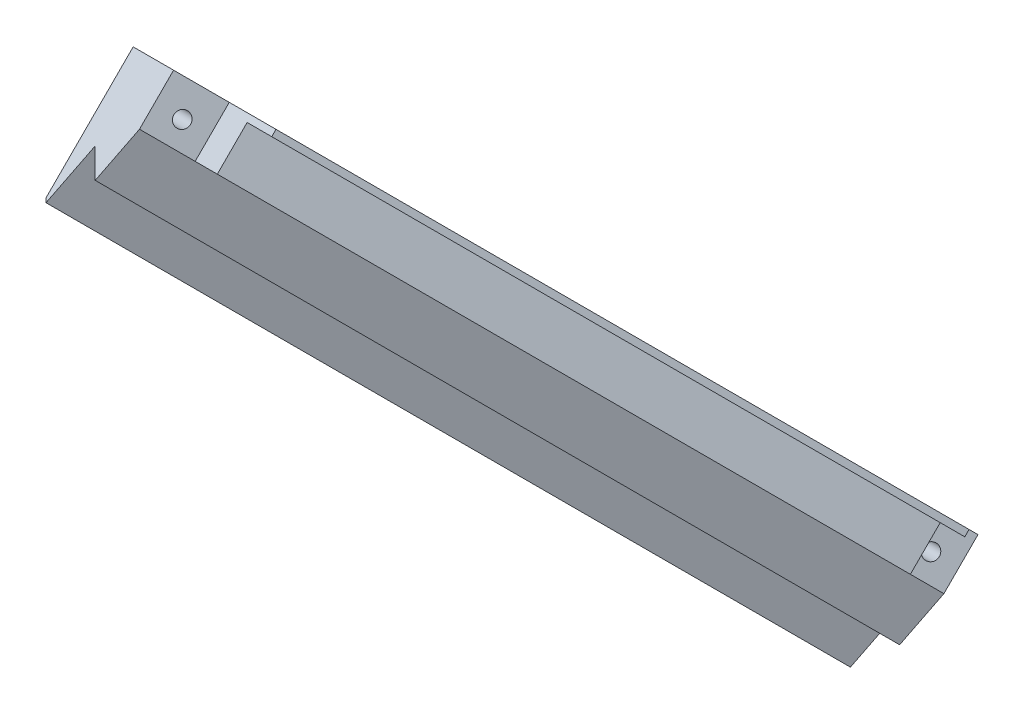
from build123d import *
from build123d.topology import SkipClean

# Parameters (mm, degrees)
STOCK_GOUX_START         = -74.233053816
STOCK_GOUX_LIKED_1_DEPTH = 57.798154544
BOSS_EXTRUDE1_DEPTH      = 57.798155
CUT_EXTRUDE1_DEPTH       = 117.763925236
SKETCH6_R                = 0.6
CUT_EXTRUDE2_DEPTH       = 156.868172362
CUT_EXTRUDE4_DEPTH       = 0.4


# Read off the part's stored shape, not the designer's step: Stock-Goux Liked-1
with BuildPart() as part:
    # Stock-Goux Liked-1 outline → Stock-Goux Liked-1 (new body)
    with BuildSketch(Plane(origin=(0, 0, 0), x_dir=(0.8164965809277323, 0.40824829046385713, 0.40824829046385636), z_dir=(0.5773502691896168, -0.5773502691896308, -0.5773502691896297)).offset(STOCK_GOUX_START)):
        Polygon((60.366452966, 115.851992166), (57.866453013, 120.182119103), (57.433440297, 119.932119095), (63.338140771, 109.704877872), (75.147541717, 109.704877872), (75.147541717, 110.204877888), (70.147541811, 110.204877888), (70.147541811, 113.704878), (65.647541921, 113.704878), (63.397541976, 117.601992222), align=None)
    extrude(amount=STOCK_GOUX_LIKED_1_DEPTH)

    # Sketch2 → Boss-Extrude1 (add)
    with SkipClean():  # the faces are left unmerged after this step: merging them gives an invalid solid
        with BuildSketch(Plane(origin=(-42.858473604, 42.858473604, 42.858473604), x_dir=(0.40824829046386124, -0.4082482904638709, 0.8164965809277231), z_dir=(-0.5773502691896168, 0.5773502691896305, 0.5773502691896301))):
            Polygon((132.580982015, -10.227241223), (123.723931305, -5.113620612), (126.676281542, 0), align=None)
        extrude(amount=-BOSS_EXTRUDE1_DEPTH)

    # Sketch5 → Cut-Extrude1 (cut, through all)
    with SkipClean():  # the faces are left unmerged after this step: merging them gives an invalid solid
        with BuildSketch(Plane(origin=(0, -80.401490288, 80.401490288), x_dir=(1, 0, 0), z_dir=(0, -0.7071067811865477, 0.7071067811865475))):
            Polygon((41.80289893, 54.586651387), (44.112300006, 51.320665064), (51.869017359, 56.805492503), (49.559616282, 60.071478827), align=None)
        cut_extrude1 = extrude(amount=-CUT_EXTRUDE1_DEPTH, mode=Mode.SUBTRACT)

    # Sketch6 → Cut-Extrude2 (cut, through all)
    with SkipClean():  # the faces are left unmerged after this step: merging them gives an invalid solid
        with BuildSketch(Plane(origin=(53.600993525, 26.800496763, 26.800496763), x_dir=(0.36514837167011016, 0.18257418583505447, -0.9128709291752772), z_dir=(0.8164965809277269, 0.4082482904638622, 0.40824829046386213))):
            with Locations(Location((-98.379129588, -56.52687032, 0), (0, 0, 90))):
                Circle(SKETCH6_R)
        cut_extrude2 = extrude(amount=-CUT_EXTRUDE2_DEPTH, mode=Mode.SUBTRACT)

    # Sketch8 → Cut-Extrude4 (cut)
    with SkipClean():  # the faces are left unmerged after this step: merging them gives an invalid solid
        with BuildSketch(Plane(origin=(0, -77.573063073, 77.573063073), x_dir=(1, 0, 0), z_dir=(0, 0.7071067811865477, -0.7071067811865475))):
            Polygon((32.655977778, -69.700657922), (32.580927697, -69.806236848), (28.99506031, -67.268526511), (28.554936111, -67.890551752), (28.062658467, -67.542014091), (28.502782665, -66.919988851), (27.305797489, -66.07281337), (27.670871608, -65.557639091), (28.867856784, -66.404814572), (30.608001015, -63.945970422), align=None)
            Polygon((29.360134428, -66.753352233), (31.50478587, -68.270890293), (30.431188114, -65.239630277), align=None, mode=Mode.SUBTRACT)
        extrude(amount=-CUT_EXTRUDE4_DEPTH, mode=Mode.SUBTRACT)

    # Mirror1: Cut-Extrude1, Cut-Extrude2 across plane
    with SkipClean():  # the faces are left unmerged after this step: merging them gives an invalid solid
        add(cut_extrude1.mirror(Plane(origin=(-26.173583561, 26.173583561, 26.173583561), x_dir=(0.40824829046388933, -0.4082482904638845, 0.8164965809277022), z_dir=(0.5773502691896123, -0.5773502691896054, -0.5773502691896596))), mode=Mode.SUBTRACT)
        add(cut_extrude2.mirror(Plane(origin=(-26.173583561, 26.173583561, 26.173583561), x_dir=(0.40824829046388933, -0.4082482904638845, 0.8164965809277022), z_dir=(0.5773502691896123, -0.5773502691896054, -0.5773502691896596))), mode=Mode.SUBTRACT)


solid = part.part
